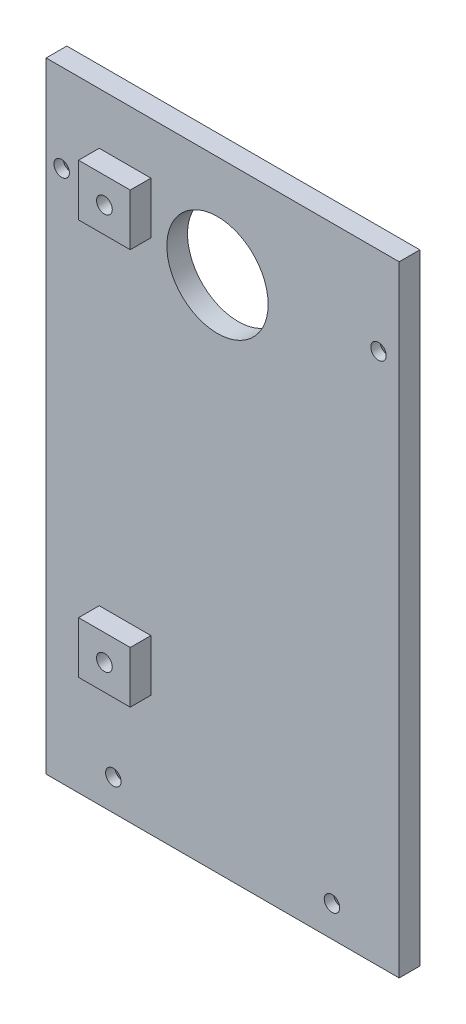
from build123d import *

# Parameters (mm, degrees)
SKETCH1_W           = 33.15
SKETCH1_H           = 60
SKETCH1_R           = 4.9
BOSS_EXTRUDE1_DEPTH = 2
SKETCH3_W           = 5
SKETCH3_H           = 5
BOSS_EXTRUDE2_DEPTH = 2
SKETCH4_R           = 0.75
CUT_EXTRUDE1_DEPTH  = 2
CHAMFER1_SIZE       = 1.1
SKETCH5_W           = 2
SKETCH5_H           = 60
BOSS_EXTRUDE3_DEPTH = 1
SKETCH7_R           = 0.762
CUT_EXTRUDE2_DEPTH  = 3.5


with BuildPart() as part:
    # Sketch1 → Boss-Extrude1 (new body)
    with BuildSketch(Plane.XY):
        Rectangle(SKETCH1_W, SKETCH1_H)
        with Locations((0, 20.1)):
            Circle(SKETCH1_R, mode=Mode.SUBTRACT)
    extrude(amount=BOSS_EXTRUDE1_DEPTH)

    # Sketch3 → Boss-Extrude2 (add)
    with BuildSketch(Plane.XY.offset(2)):
        with Locations((-8.94, 22.5)):
            Rectangle(SKETCH3_W, SKETCH3_H)
        with Locations((-8.94, -15.82)):
            Rectangle(SKETCH3_W, SKETCH3_H)
    extrude(amount=BOSS_EXTRUDE2_DEPTH)

    # Sketch4 → Cut-Extrude1 (cut)
    with BuildSketch(Plane(origin=(0, 0, 0), x_dir=(-1, 0, 0), z_dir=(0, 0, -1))):
        with Locations((-15.575, 21.5)):
            Circle(SKETCH4_R)
        with Locations((15.075, 21.5)):
            Circle(SKETCH4_R)
        with Locations((10.075, -27)):
            Circle(SKETCH4_R)
        with Locations((-11.075, -27)):
            Circle(SKETCH4_R)
    extrude(amount=-CUT_EXTRUDE1_DEPTH, mode=Mode.SUBTRACT)

    # Chamfer1
    # the kernel refuses this chamfer: 1.1 mm, written as the material it takes off along each edge
    with BuildSketch(Plane(origin=(15.575, 21.5, 0), x_dir=(-1, 0, 0), z_dir=(0, -1, 0))) as chamfer1_piece_1:
        Polygon((0.75 + CHAMFER1_SIZE, 0), (0.75, -CHAMFER1_SIZE), (0.75, 0), align=None)
    revolve(axis=Axis((15.575, 21.5, 0), (0, 0, -1)), mode=Mode.SUBTRACT)
    with BuildSketch(Plane(origin=(-15.075, 21.5, 0), x_dir=(-1, 0, 0), z_dir=(0, -1, 0))) as chamfer1_piece_2:
        Polygon((0.75 + CHAMFER1_SIZE, 0), (0.75, -CHAMFER1_SIZE), (0.75, 0), align=None)
    revolve(axis=Axis((-15.075, 21.5, 0), (0, 0, -1)), mode=Mode.SUBTRACT)
    with BuildSketch(Plane(origin=(-10.075, -27, 0), x_dir=(-1, 0, 0), z_dir=(0, -1, 0))) as chamfer1_piece_3:
        Polygon((0.75 + CHAMFER1_SIZE, 0), (0.75, -CHAMFER1_SIZE), (0.75, 0), align=None)
    revolve(axis=Axis((-10.075, -27, 0), (0, 0, -1)), mode=Mode.SUBTRACT)
    with BuildSketch(Plane(origin=(11.075, -27, 0), x_dir=(-1, 0, 0), z_dir=(0, -1, 0))) as chamfer1_piece_4:
        Polygon((0.75 + CHAMFER1_SIZE, 0), (0.75, -CHAMFER1_SIZE), (0.75, 0), align=None)
    revolve(axis=Axis((11.075, -27, 0), (0, 0, -1)), mode=Mode.SUBTRACT)

    # Sketch5 → Boss-Extrude3 (add)
    with BuildSketch(Plane(origin=(16.575, 0, 0), x_dir=(0, 0, -1), z_dir=(1, 0, 0))):
        with Locations((-1, 0)):
            Rectangle(SKETCH5_W, SKETCH5_H)
    extrude(amount=BOSS_EXTRUDE3_DEPTH)

    # Sketch7 → Cut-Extrude2 (cut)
    with BuildSketch(Plane.XY.offset(4)):
        with Locations((-8.94, 22.5)):
            Circle(SKETCH7_R)
        with Locations((-8.94, -15.82)):
            Circle(SKETCH7_R)
    extrude(amount=-CUT_EXTRUDE2_DEPTH, mode=Mode.SUBTRACT)


solid = part.part
